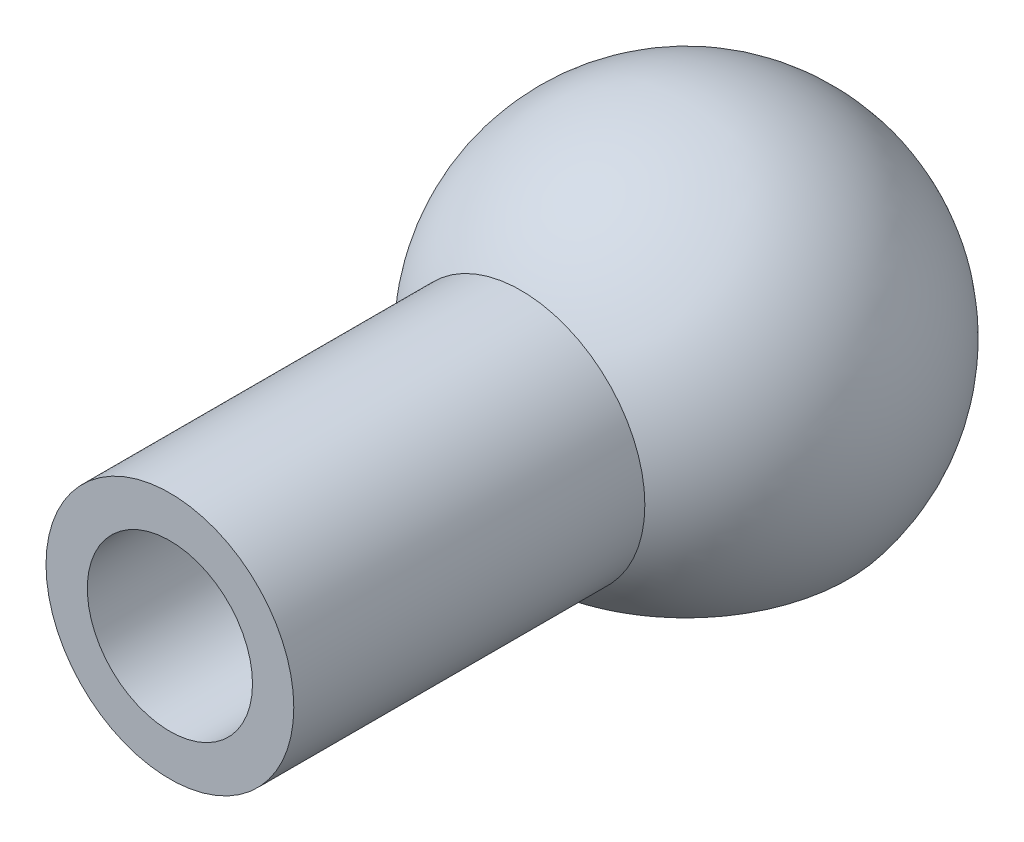
from build123d import *
from OCP.BRepAlgoAPI import BRepAlgoAPI_Cut
from OCP.TopTools import TopTools_ListOfShape

# Parameters (mm, degrees)
SKETCH_1_R          = 6
SKETCH_1_R_2        = 4
EXTRUDE_1_DEPTH     = 25
CUT_EXTRUDE_START   = -17
SKETCH_3_R          = 4
CUT_EXTRUDE_2_DEPTH = 17


with BuildPart() as part:
    # 草图1 → 凸台-拉伸1 (new body)
    with BuildSketch(Plane.XY):
        Circle(SKETCH_1_R)
        Circle(SKETCH_1_R_2, mode=Mode.SUBTRACT)
    extrude(amount=EXTRUDE_1_DEPTH)

    # 草图2 → 旋转3 (revolve)
    with BuildSketch(Plane(origin=(0, 0, 0), x_dir=(1, 0, 0), z_dir=(0, 1, 0))):
        with BuildLine():
            Line((0, 10), (0, -10))
            ThreePointArc((0, -10), (-10, 0), (0, 10))
        make_face()
    revolve(axis=Axis((0, 0, 0), (0, 0, -1)))

    # 草图3 → 切除-拉伸2 (cut)
    with BuildSketch(Plane.XY.offset(25).offset(CUT_EXTRUDE_START)):
        Circle(SKETCH_3_R)
    extrude(amount=CUT_EXTRUDE_2_DEPTH, mode=Mode.SUBTRACT)


with BuildPart() as cut_revolve_1_tool:
    # 草图4 → 切除-旋转1 (revolve)
    with BuildSketch(Plane(origin=(0, 0, 0), x_dir=(0, 0, -1), z_dir=(1, 0, 0))):
        with BuildLine():
            Line((0, 7), (0, -7))
            Line((0, -7), (0, -10))
            Line((0, -10), (6, -10))
            Line((6, -10), (7.857142857, -6.185895741))
            Line((7.857142857, -6.185895741), (5.5, -4.330127019))
            ThreePointArc((5.5, -4.330127019), (6.297256908, 3.056886559), (0, 7))
        make_face()
    revolve(axis=Axis((0, 0, 0), (0, 1, 0)))


with BuildPart() as part_1:
    add(part.part)

    # 切除-旋转1: cut by cut_revolve_1_tool, with a tolerance
    cut_revolve_1_stock = TopTools_ListOfShape()
    cut_revolve_1_stock.Append(part_1.part.wrapped)
    cut_revolve_1_tools = TopTools_ListOfShape()
    cut_revolve_1_tools.Append(cut_revolve_1_tool.part.wrapped)
    cut_revolve_1_cut = BRepAlgoAPI_Cut()
    cut_revolve_1_cut.SetArguments(cut_revolve_1_stock)
    cut_revolve_1_cut.SetTools(cut_revolve_1_tools)
    cut_revolve_1_cut.SetFuzzyValue(0.00001)
    cut_revolve_1_cut.Build()
    add(Compound.cast(cut_revolve_1_cut.Shape()).solids(), mode=Mode.REPLACE)


solid = part_1.part
